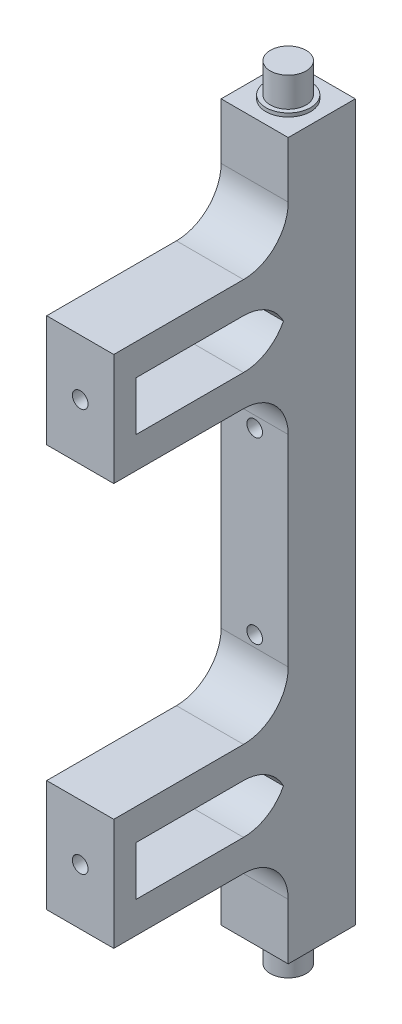
from build123d import *

# Parameters (mm, degrees)
ESQUISSE1_W                      = 25
ESQUISSE1_H                      = 15
BOSS_EXTRU_1_DEPTH               = 39
BOSS_EXTRU_1_2_DEPTH             = 39
ESQUISSE3_W                      = 160
ESQUISSE3_H                      = 15
BOSS_EXTRU_2_DEPTH               = 15
ESQUISSE4_R                      = 5
ESQUISSE4_R_2                    = 4
BOSS_EXTRU_5_DEPTH               = 0.8
ESQUISSE4_6_R                    = 4
BOSS_EXTRU_6_DEPTH               = 7.4
CONG_1_R                         = 10
ESQUISSE5_W                      = 11
ESQUISSE5_H                      = 34
ENL_V_MAT_EXTRU_1_DEPTH          = 97.874970968
CONG_2_R                         = 10
ESQUISSE6_R                      = 1.75
ENL_V_MAT_EXTRU_2_DEPTH          = 101.478903258
ESQUISSE11_R                     = 1.75
TROUS_VIS_SUPPORT_CAPTEURS_DEPTH = 97.000052083


with BuildPart() as part:
    # Esquisse1 → Boss.-Extru.1 (new body)
    with BuildSketch(Plane(origin=(0, 0, 0), x_dir=(0, 1, 0), z_dir=(0, 0, 1))):
        with Locations((-45, 0)):
            Rectangle(ESQUISSE1_W, ESQUISSE1_H)
    extrude(amount=BOSS_EXTRU_1_DEPTH)



with BuildPart() as body_2:
    # Esquisse1 → Boss.-Extru.1 2 (new body)
    with BuildSketch(Plane(origin=(0, 0, 0), x_dir=(0, 1, 0), z_dir=(0, 0, 1))):
        with Locations((45, 0)):
            Rectangle(ESQUISSE1_W, ESQUISSE1_H)
    extrude(amount=BOSS_EXTRU_1_2_DEPTH)


with BuildPart() as part_1:
    add(part.part)

    add(body_2.part)  # Boss.-Extru.2 merges body 2
    # Esquisse3 → Boss.-Extru.2 (add)
    with BuildSketch(Plane(origin=(0, 0, 0), x_dir=(0, 1, 0), z_dir=(0, 0, 1))):
        Rectangle(ESQUISSE3_W, ESQUISSE3_H)
    extrude(amount=-BOSS_EXTRU_2_DEPTH)

    # Esquisse4 → Boss.-Extru.5 (add)
    with BuildSketch(Plane(origin=(0, -80, 0), x_dir=(-1, 0, 0), z_dir=(0, -1, 0))):
        with Locations(Location((0, 7.5, 0), (0, 0, 90))):
            Circle(ESQUISSE4_R)
        with Locations(Location((0, 7.5, 0), (0, 0, 90))):
            Circle(ESQUISSE4_R_2, mode=Mode.SUBTRACT)
    boss_extru_5 = extrude(amount=BOSS_EXTRU_5_DEPTH)

    # Esquisse4<6> → Boss.-Extru.6 (add)
    with BuildSketch(Plane(origin=(0, -80, 0), x_dir=(-1, 0, 0), z_dir=(0, -1, 0))):
        with Locations(Location((0, 7.5, 0), (0, 0, 90))):
            Circle(ESQUISSE4_6_R)
    boss_extru_6 = extrude(amount=BOSS_EXTRU_6_DEPTH)

    # Symétrie2: Boss.-Extru.5, Boss.-Extru.6 across plane
    add(boss_extru_5.mirror(Plane.ZX))
    add(boss_extru_6.mirror(Plane.ZX))

    # Congé1
    cong_1_edges = [part_1.edges().sort_by_distance(p)[0] for p in [
        (0, 57.5, 0),
        (0, 32.5, 0),
        (0, -57.5, 0),
        (0, -32.5, 0),
    ]]
    fillet(cong_1_edges, radius=CONG_1_R)

    # Esquisse5 → Enlèv. mat.-Extru.1 (cut, through all)
    with BuildSketch(Plane(origin=(-7.5, 0, 0), x_dir=(0, -1, 0), z_dir=(-1, 0, 0))):
        with Locations((45, 17)):
            Rectangle(ESQUISSE5_W, ESQUISSE5_H)
        with Locations((-45, 17)):
            Rectangle(ESQUISSE5_W, ESQUISSE5_H)
    extrude(amount=-ENL_V_MAT_EXTRU_1_DEPTH, mode=Mode.SUBTRACT)

    # Congé2
    # the kernel refuses this fillet: 10 mm, written as the material it adds along each edge
    with BuildSketch(Plane(origin=(-7.5, 39.5, 0), x_dir=(0, 0, 1), z_dir=(1, 0, 0)), Plane(origin=(-7.5, -39.5, 0), x_dir=(0, -1, 0), z_dir=(1, 0, 0)), Plane(origin=(-7.5, -50.5, 0), x_dir=(0, 0, 1), z_dir=(1, 0, 0))) as cong_2_piece_1:
        with BuildLine():
            CenterArc((CONG_2_R, -CONG_2_R), CONG_2_R, 90, 90)
            Line((0, -CONG_2_R), (0, 0))
            Line((0, 0), (CONG_2_R, 0))
        make_face()
    extrude(amount=15)
    with BuildSketch(Plane(origin=(-7.5, 50.5, 0), x_dir=(0, 0, 1), z_dir=(1, 0, 0))) as cong_2_piece_2:
        with BuildLine():
            CenterArc((CONG_2_R, CONG_2_R), CONG_2_R, 180, 90)
            Line((0, CONG_2_R), (0, 0))
            Line((0, 0), (CONG_2_R, 0))
        make_face()
    extrude(amount=15)

    # Esquisse6 → Enlèv. mat.-Extru.2 (cut, through all)
    with BuildSketch(Plane(origin=(0, 0, 34), x_dir=(1, 0, 0), z_dir=(0, 0, -1))):
        with Locations(Location((0, 45, 0), (0, 0, 180))):
            Circle(ESQUISSE6_R)
        with Locations((0, -45)):
            Circle(ESQUISSE6_R)
    extrude(amount=-ENL_V_MAT_EXTRU_2_DEPTH, mode=Mode.SUBTRACT)

    # Esquisse11 → Trous vis support capteurs (cut, through all)
    with BuildSketch(Plane(origin=(0, 0, 0), x_dir=(0, 1, 0), z_dir=(0, 0, 1))):
        with Locations(Location((20, 0, 0), (0, 0, 270))):
            Circle(ESQUISSE11_R)
        with Locations(Location((-20, 0, 0), (0, 0, 270))):
            Circle(ESQUISSE11_R)
    extrude(amount=-TROUS_VIS_SUPPORT_CAPTEURS_DEPTH, mode=Mode.SUBTRACT)


solid = part_1.part
